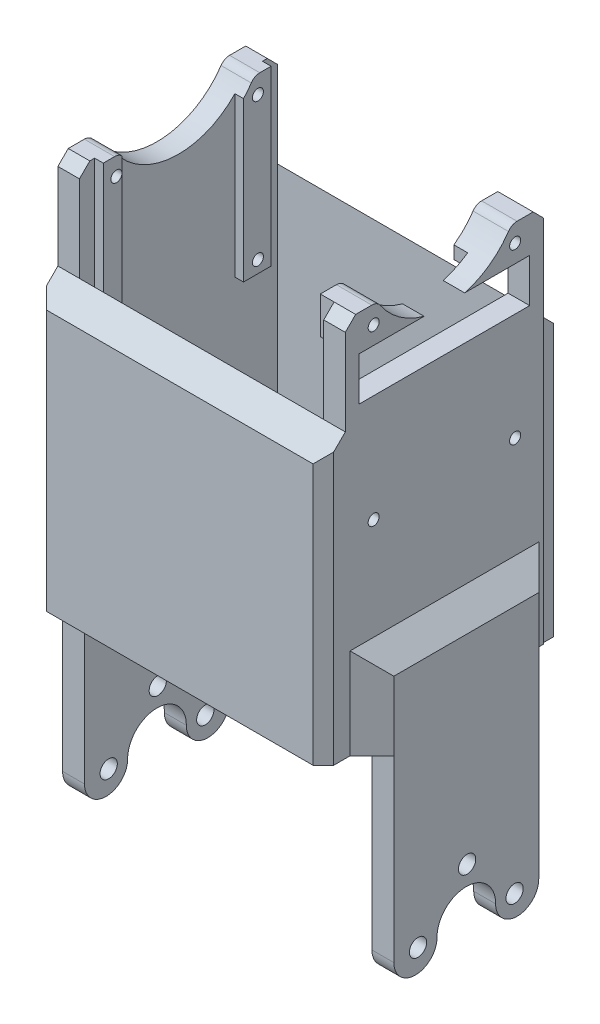
from build123d import *

# Parameters (mm, degrees)
BOSS_EXTRUDE1_DEPTH = 28.72
SKETCH2_R           = 11.2
CUT_EXTRUDE1_DEPTH  = 73.460862022
FILLET2_R           = 1.5
SKETCH3_W           = 41.45
SKETCH3_H           = 41
BOSS_EXTRUDE2_DEPTH = 3.175
SKETCH4_W           = 41.65
SKETCH4_H           = 41
BOSS_EXTRUDE3_DEPTH = 3.175
CHAMFER1_SIZE       = 3.175
CHAMFER2_SIZE       = 1.5
CHAMFER3_SIZE       = 1.5
BOSS_EXTRUDE4_START = 1.25
SKETCH5_R           = 0.8
BOSS_EXTRUDE4_DEPTH = 1.25
CUT_EXTRUDE2_REACH  = 74.059
SKETCH6_R           = 0.8
CUT_EXTRUDE3_REACH  = 76.34
SKETCH7_R           = 1.35
SKETCH8_R           = 0.8
SKETCH8_W           = 28.72
SKETCH8_H           = 4.5
SKETCH8_R_2         = 0.875750987
BOSS_EXTRUDE5_DEPTH = 2
CUT_EXTRUDE4_REACH  = 74.059
SKETCH9_R           = 0.800014392
SKETCH9_R_2         = 0.80001441
SKETCH9_R_3         = 0.800015836
SKETCH9_R_4         = 0.800011974
SKETCH9_W           = 24.720018
SKETCH9_H           = 6.307795688
BOSS_EXTRUDE6_DEPTH = 3.175


# Some blends are built 0.0001 mm under size
with BuildPart() as part:
    # Sketch1 → Boss-Extrude1 (new body)
    with BuildSketch(Plane.XY):
        Polygon((0, 0), (35.4, 0), (35.4, 51.875), (38.525, 51.875), (38.525, -3.125), (-3.125, -3.125), (-3.125, 51.875), (0, 51.875), align=None)
    extrude(amount=BOSS_EXTRUDE1_DEPTH)

    # Sketch2 → Cut-Extrude1 (cut, through all)
    with BuildSketch(Plane(origin=(38.525, 0, 0), x_dir=(0, 0, -1), z_dir=(1, 0, 0))):
        with Locations((-14.36, 57.485)):
            Circle(SKETCH2_R)
    extrude(amount=-CUT_EXTRUDE1_DEPTH, mode=Mode.SUBTRACT)

    # Fillet2
    fillet2_edges = [part.edges().sort_by_distance(p)[0] for p in [
        (-1.5625, 51.875, 4.666295858),
        (-1.5625, 51.875, 24.053704142),
        (36.9625, 51.875, 4.666295858),
        (36.9625, 51.875, 24.053704142),
    ]]
    fillet(fillet2_edges, radius=FILLET2_R)

    # Sketch3 → Boss-Extrude2 (add)
    with BuildSketch(Plane(origin=(0, 0, 0), x_dir=(-1, 0, 0), z_dir=(0, 0, -1))):
        with Locations((-17.6, 17.375)):
            Rectangle(SKETCH3_W, SKETCH3_H)
    extrude(amount=BOSS_EXTRUDE2_DEPTH)

    # Sketch4 → Boss-Extrude3 (add)
    with BuildSketch(Plane.XY.offset(28.72)):
        with Locations((17.7, 17.375)):
            Rectangle(SKETCH4_W, SKETCH4_H)
    extrude(amount=BOSS_EXTRUDE3_DEPTH)

    # Chamfer1
    chamfer1_edges = [part.edges().sort_by_distance(p)[0] for p in [
        (17.6, 37.875, -3.175),
        (17.7, 37.875, 31.895),
    ]]
    chamfer(chamfer1_edges, length=CHAMFER1_SIZE - 0.0001)  # a hair under: the kernel refuses the full size

    # Chamfer2
    chamfer2_edges = [part.edges().sort_by_distance(p)[0] for p in [
        (-1.5625, 51.875, 0),
        (36.9625, 51.875, 28.72),
        (-1.5625, 51.875, 28.72),
        (36.9625, 51.875, 0),
    ]]
    chamfer(chamfer2_edges, length=CHAMFER2_SIZE)

    # Chamfer3
    chamfer3_edges = [part.edges().sort_by_distance(p)[0] for p in [
        (38.325, 15.78755, -3.175),
        (-3.125, 15.78755, 31.895),
        (-3.125, 15.78755, -3.175),
        (38.525, 15.78755, 31.895),
    ]]
    chamfer(chamfer3_edges, length=CHAMFER3_SIZE)

    # Sketch5 → Boss-Extrude4 (add)
    # profile 1 of 2: a face of its own
    with BuildSketch(Plane(origin=(0, 0, 0), x_dir=(0, 0, -1), z_dir=(1, 0, 0)).offset(BOSS_EXTRUDE4_START)):
        with BuildLine():
            Line((-2.200583574, 26.790766865), (-2.200583574, 51.875))
            Line((-2.200583574, 51.875), (-3.836792314, 51.875))
            ThreePointArc((-3.836792314, 51.875), (-4.540480573, 51.699697262), (-5.07969086, 51.21476378))
            ThreePointArc((-5.07969086, 51.21476378), (-5.612003622, 50.491248548), (-6.200583574, 49.812717186))
            Line((-6.200583574, 49.812717186), (-6.200583574, 26.790766865))
            Line((-6.200583574, 26.790766865), (-2.200583574, 26.790766865))
        make_face()
        with Locations((-4.11, 28.560750987)):
            Circle(SKETCH5_R, mode=Mode.SUBTRACT)
        with Locations((-4.11, 49.260750987)):
            Circle(SKETCH5_R, mode=Mode.SUBTRACT)
    # profile 2 of 2: a face of its own
    with BuildSketch(Plane(origin=(0, 0, 0), x_dir=(0, 0, -1), z_dir=(1, 0, 0)).offset(BOSS_EXTRUDE4_START)):
        with BuildLine():
            Line((-23.77972879, 26.790766865), (-23.77972879, 51.391038545))
            ThreePointArc((-23.77972879, 51.391038545), (-24.280736864, 51.748691708), (-24.883207686, 51.875))
            Line((-24.883207686, 51.875), (-26.51940138, 51.875))
            Line((-26.51940138, 51.875), (-26.51940138, 26.790766865))
            Line((-26.51940138, 26.790766865), (-23.77972879, 26.790766865))
        make_face()
        with Locations((-24.61, 28.560750987)):
            Circle(SKETCH5_R, mode=Mode.SUBTRACT)
        with Locations((-24.61, 49.260750987)):
            Circle(SKETCH5_R, mode=Mode.SUBTRACT)
    extrude(amount=-BOSS_EXTRUDE4_DEPTH)

    # Sketch6 → Cut-Extrude2 (cut, up to next)
    with BuildSketch(Plane(origin=(0, 0, 0), x_dir=(0, 0, -1), z_dir=(1, 0, 0)), mode=Mode.PRIVATE) as cut_extrude2_sk1:
        with Locations((-24.61, 49.260750987)):
            Circle(SKETCH6_R)
    cut_extrude2_tool1 = extrude(cut_extrude2_sk1.sketch, amount=-CUT_EXTRUDE2_REACH, mode=Mode.PRIVATE) & part.part
    # Sketch6 → Cut-Extrude2 (cut, up to next)
    with BuildSketch(Plane(origin=(0, 0, 0), x_dir=(0, 0, -1), z_dir=(1, 0, 0)), mode=Mode.PRIVATE) as cut_extrude2_sk2:
        with Locations((-24.61, 28.560750987)):
            Circle(SKETCH6_R)
    cut_extrude2_tool2 = extrude(cut_extrude2_sk2.sketch, amount=-CUT_EXTRUDE2_REACH, mode=Mode.PRIVATE) & part.part
    # Sketch6 → Cut-Extrude2 (cut, up to next)
    with BuildSketch(Plane(origin=(0, 0, 0), x_dir=(0, 0, -1), z_dir=(1, 0, 0)), mode=Mode.PRIVATE) as cut_extrude2_sk3:
        with Locations((-4.11, 28.560750987)):
            Circle(SKETCH6_R)
    cut_extrude2_tool3 = extrude(cut_extrude2_sk3.sketch, amount=-CUT_EXTRUDE2_REACH, mode=Mode.PRIVATE) & part.part
    # Sketch6 → Cut-Extrude2 (cut, up to next)
    with BuildSketch(Plane(origin=(0, 0, 0), x_dir=(0, 0, -1), z_dir=(1, 0, 0)), mode=Mode.PRIVATE) as cut_extrude2_sk4:
        with Locations((-4.11, 49.260750987)):
            Circle(SKETCH6_R)
    cut_extrude2_tool4 = extrude(cut_extrude2_sk4.sketch, amount=-CUT_EXTRUDE2_REACH, mode=Mode.PRIVATE) & part.part
    add(cut_extrude2_tool1.solids().sort_by_distance((0, 49.260751, 24.61))[0], mode=Mode.SUBTRACT)
    add(cut_extrude2_tool2.solids().sort_by_distance((0, 28.560751, 24.61))[0], mode=Mode.SUBTRACT)
    add(cut_extrude2_tool3.solids().sort_by_distance((0, 28.560751, 4.11))[0], mode=Mode.SUBTRACT)
    add(cut_extrude2_tool4.solids().sort_by_distance((0, 49.260751, 4.11))[0], mode=Mode.SUBTRACT)

    # Sketch7 → Cut-Extrude3 (cut, up to next)
    with BuildSketch(Plane.XZ.offset(3.125), mode=Mode.PRIVATE) as cut_extrude3_sk1:
        with Locations(Location((11.7, 22.36, 0), (0, 0, 270))):
            Circle(SKETCH7_R)
    cut_extrude3_tool1 = extrude(cut_extrude3_sk1.sketch, amount=-CUT_EXTRUDE3_REACH, mode=Mode.PRIVATE) & part.part
    # Sketch7 → Cut-Extrude3 (cut, up to next)
    with BuildSketch(Plane.XZ.offset(3.125), mode=Mode.PRIVATE) as cut_extrude3_sk2:
        with Locations(Location((23.7, 22.36, 0), (0, 0, 270))):
            Circle(SKETCH7_R)
    cut_extrude3_tool2 = extrude(cut_extrude3_sk2.sketch, amount=-CUT_EXTRUDE3_REACH, mode=Mode.PRIVATE) & part.part
    # Sketch7 → Cut-Extrude3 (cut, up to next)
    with BuildSketch(Plane.XZ.offset(3.125), mode=Mode.PRIVATE) as cut_extrude3_sk3:
        with Locations(Location((23.7, 6.359998127, 0), (0, 0, 270))):
            Circle(SKETCH7_R)
    cut_extrude3_tool3 = extrude(cut_extrude3_sk3.sketch, amount=-CUT_EXTRUDE3_REACH, mode=Mode.PRIVATE) & part.part
    # Sketch7 → Cut-Extrude3 (cut, up to next)
    with BuildSketch(Plane.XZ.offset(3.125), mode=Mode.PRIVATE) as cut_extrude3_sk4:
        with Locations(Location((11.7, 6.359998127, 0), (0, 0, 270))):
            Circle(SKETCH7_R)
    cut_extrude3_tool4 = extrude(cut_extrude3_sk4.sketch, amount=-CUT_EXTRUDE3_REACH, mode=Mode.PRIVATE) & part.part
    add(cut_extrude3_tool1.solids().sort_by_distance((11.7, -3.125, 22.36))[0], mode=Mode.SUBTRACT)
    add(cut_extrude3_tool2.solids().sort_by_distance((23.7, -3.125, 22.36))[0], mode=Mode.SUBTRACT)
    add(cut_extrude3_tool3.solids().sort_by_distance((23.7, -3.125, 6.359998))[0], mode=Mode.SUBTRACT)
    add(cut_extrude3_tool4.solids().sort_by_distance((11.7, -3.125, 6.359998))[0], mode=Mode.SUBTRACT)

    # Sketch8 → Boss-Extrude5 (add)
    # profile 1 of 3: a face of its own
    with BuildSketch(Plane.ZY.offset(-35.4)):
        with BuildLine():
            ThreePointArc((23.64030914, 51.21476378), (22.377857963, 49.66490066), (20.86, 48.364144777))
            Line((20.86, 48.364144777), (20.86, 46.516373578))
            Line((20.86, 46.516373578), (27.22, 46.516373578))
            Line((27.22, 46.516373578), (27.22, 51.875))
            Line((27.22, 51.875), (24.883207686, 51.875))
            ThreePointArc((24.883207686, 51.875), (24.179519427, 51.699697262), (23.64030914, 51.21476378))
        make_face()
        with Locations(Location((24.61, 49.260750667, 0), (0, 0, 179.999977125))):
            Circle(SKETCH8_R, mode=Mode.SUBTRACT)
    # profile 2 of 3: a face of its own
    with BuildSketch(Plane.ZY.offset(-35.4)):
        with BuildLine():
            Line((3.836792314, 51.875), (1.5, 51.875))
            Line((1.5, 51.875), (1.5, 46.516373578))
            Line((1.5, 46.516373578), (7.86, 46.516373578))
            Line((7.86, 46.516373578), (7.86, 48.364144777))
            ThreePointArc((7.86, 48.364144777), (6.342142037, 49.66490066), (5.07969086, 51.21476378))
            ThreePointArc((5.07969086, 51.21476378), (4.540480573, 51.699697262), (3.836792314, 51.875))
        make_face()
        with Locations(Location((4.11, 49.260750667, 0), (0, 0, 179.999977125))):
            Circle(SKETCH8_R, mode=Mode.SUBTRACT)
    # profile 3 of 3: a face of its own
    with BuildSketch(Plane.ZY.offset(-35.4)):
        with Locations((14.36, 24.810750667)):
            Rectangle(SKETCH8_W, SKETCH8_H)
        with Locations((4.11, 24.810750667)):
            Circle(SKETCH8_R, mode=Mode.SUBTRACT)
        with Locations((24.61, 24.734999681)):
            Circle(SKETCH8_R_2, mode=Mode.SUBTRACT)
    extrude(amount=BOSS_EXTRUDE5_DEPTH)

    # Sketch9 → Cut-Extrude4 (cut, up to next)
    with BuildSketch(Plane.ZY.offset(-35.4), mode=Mode.PRIVATE) as cut_extrude4_sk1:
        with Locations((24.609993853, 24.810730685)):
            Circle(SKETCH9_R)
    cut_extrude4_tool1 = extrude(cut_extrude4_sk1.sketch, amount=-CUT_EXTRUDE4_REACH, mode=Mode.PRIVATE) & part.part
    # Sketch9 → Cut-Extrude4 (cut, up to next)
    with BuildSketch(Plane.ZY.offset(-35.4), mode=Mode.PRIVATE) as cut_extrude4_sk2:
        with Locations((4.109993853, 24.810730685)):
            Circle(SKETCH9_R_2)
    cut_extrude4_tool2 = extrude(cut_extrude4_sk2.sketch, amount=-CUT_EXTRUDE4_REACH, mode=Mode.PRIVATE) & part.part
    # Sketch9 → Cut-Extrude4 (cut, up to next)
    with BuildSketch(Plane.ZY.offset(-35.4), mode=Mode.PRIVATE) as cut_extrude4_sk3:
        with Locations((4.109993242, 49.260730684)):
            Circle(SKETCH9_R_3)
    cut_extrude4_tool3 = extrude(cut_extrude4_sk3.sketch, amount=-CUT_EXTRUDE4_REACH, mode=Mode.PRIVATE) & part.part
    # Sketch9 → Cut-Extrude4 (cut, up to next)
    with BuildSketch(Plane.ZY.offset(-35.4), mode=Mode.PRIVATE) as cut_extrude4_sk4:
        with Locations((24.609993853, 49.260730685)):
            Circle(SKETCH9_R_4)
    cut_extrude4_tool4 = extrude(cut_extrude4_sk4.sketch, amount=-CUT_EXTRUDE4_REACH, mode=Mode.PRIVATE) & part.part
    # Sketch9 → Cut-Extrude4 (cut, up to next)
    with BuildSketch(Plane.ZY.offset(-35.4), mode=Mode.PRIVATE) as cut_extrude4_sk5:
        with Locations((14.359996578, 43.522958594)):
            Rectangle(SKETCH9_W, SKETCH9_H)
    cut_extrude4_tool5 = extrude(cut_extrude4_sk5.sketch, amount=-CUT_EXTRUDE4_REACH, mode=Mode.PRIVATE) & part.part
    add(cut_extrude4_tool1.solids().sort_by_distance((35.4, 24.810731, 24.609994))[0], mode=Mode.SUBTRACT)
    add(cut_extrude4_tool2.solids().sort_by_distance((35.4, 24.810731, 4.109994))[0], mode=Mode.SUBTRACT)
    add(cut_extrude4_tool3.solids().sort_by_distance((35.4, 49.260731, 4.109993))[0], mode=Mode.SUBTRACT)
    add(cut_extrude4_tool4.solids().sort_by_distance((35.4, 49.260731, 24.609994))[0], mode=Mode.SUBTRACT)
    add(cut_extrude4_tool5.solids().sort_by_distance((35.4, 43.522959, 14.359997))[0], mode=Mode.SUBTRACT)

    # Sketch10 → Boss-Extrude6 (add)
    with BuildSketch(Plane.ZY.offset(3.125)):
        with BuildLine():
            Line((3.86000082, 6.875), (24.86000082, 6.875))
            Line((24.86000082, 6.875), (24.86000082, -29.069076968))
            add(Edge.make_bspline(
                [(18.609772252, -29.069076968), (18.609772252, -35.319305536), (24.86000082, -35.319305536), (24.86000082, -29.069076968)],
                knots=[0, 0, 0, 0, 1, 1, 1, 1], degree=3, weights=[1, 0.333333333, 0.333333333, 1]))
            add(Edge.make_bspline(
                [(10.110229389, -29.069076968), (10.084196873, -26.559098439), (11.849887296, -24.775), (14.36000082, -24.775), (16.870114345, -24.775), (18.635804768, -26.559098439), (18.609772252, -29.069076968)],
                knots=[0, 0, 0, 0, 0.5, 0.5, 0.5, 1, 1, 1, 1], degree=3, weights=[1, 0.802287003, 0.802287003, 1, 0.802287003, 0.802287003, 1]))
            add(Edge.make_bspline(
                [(3.86000082, -29.069077053), (3.86000082, -30.899726637), (5.154465564, -32.194191363), (6.985115147, -32.194191338), (8.815764731, -32.194191313), (10.110229439, -30.899726551), (10.110229389, -29.069076968)],
                knots=[0, 0, 0, 0, 0.5, 0.5, 0.5, 1, 1, 1, 1], degree=3, weights=[1, 0.804737851, 0.804737851, 1, 0.804737851, 0.804737851, 1]))
            Line((3.86000082, -29.069077053), (3.86000082, 6.875))
        make_face()
        with BuildLine():
            add(Edge.make_bspline(
                [(6.111158371, -29.163426519), (6.123444486, -29.895556484), (6.649826144, -30.404562953), (7.38195611, -30.392276838)],
                knots=[0, 0, 0, 0, 1, 1, 1, 1], degree=3, weights=[1, 0.804737854, 0.804737854, 1]))
            add(Edge.make_bspline(
                [(6.111158371, -29.163426519), (6.089205787, -27.855271412), (7.289382626, -27.334380583), (8.229910793, -28.24386311), (9.170438961, -29.153345636), (8.690111217, -30.370324254), (7.38195611, -30.392276838)],
                knots=[0, 0, 0, 0, 0.5, 0.5, 0.5, 1, 1, 1, 1], degree=3, weights=[1, 0.588455622, 0.588455622, 1, 0.588455622, 0.588455622, 1]))
        make_face(mode=Mode.SUBTRACT)
        with BuildLine():
            add(Edge.make_bspline(
                [(14.221572316, -20.776159536), (13.489442351, -20.788445651), (12.980435882, -21.314827309), (12.992721997, -22.046957275)],
                knots=[0, 0, 0, 0, 1, 1, 1, 1], degree=3, weights=[1, 0.804737854, 0.804737854, 1]))
            add(Edge.make_bspline(
                [(14.221572316, -20.776159536), (15.529727423, -20.754206952), (16.050618252, -21.954383791), (15.141135725, -22.894911958), (14.231653199, -23.835440126), (13.014674581, -23.355112382), (12.992721997, -22.046957275)],
                knots=[0, 0, 0, 0, 0.5, 0.5, 0.5, 1, 1, 1, 1], degree=3, weights=[1, 0.588455622, 0.588455622, 1, 0.588455622, 0.588455622, 1]))
        make_face(mode=Mode.SUBTRACT)
        with BuildLine():
            add(Edge.make_bspline(
                [(22.608839299, -28.886573481), (22.596553184, -28.154443516), (22.070171526, -27.645437047), (21.33804156, -27.657723162)],
                knots=[0, 0, 0, 0, 1, 1, 1, 1], degree=3, weights=[1, 0.804737854, 0.804737854, 1]))
            add(Edge.make_bspline(
                [(22.608839299, -28.886573481), (22.630791883, -30.194728588), (21.430615044, -30.715619417), (20.490086877, -29.80613689), (19.549558709, -28.896654364), (20.029886453, -27.679675746), (21.33804156, -27.657723162)],
                knots=[0, 0, 0, 0, 0.5, 0.5, 0.5, 1, 1, 1, 1], degree=3, weights=[1, 0.588455622, 0.588455622, 1, 0.588455622, 0.588455622, 1]))
        make_face(mode=Mode.SUBTRACT)
    boss_extrude6 = extrude(amount=BOSS_EXTRUDE6_DEPTH)

    # Chamfer8
    # the kernel refuses this chamfer: 3.175 mm, written as the material it adds along each edge
    with BuildSketch(Plane(origin=(-3.125, -3.125, 3.86000082), x_dir=(0.027495876610586334, 0, -0.9996219169112966), z_dir=(0, 1, 0))) as chamfer8_piece_1_section:
        with BuildLine():
            Line((3.266037395, 0), (-0.179537217, 3.261098994))
            Line((-0.179537217, 3.261098994), (-0.243013208, 3.259353006))
            ThreePointArc((-0.243013208, 3.259353006), (-0.108360296, 1.630038109), (-0.063475992, -0.001745988))
            Line((-0.063475992, -0.001745988), (0.001745988, -0.063475992))
            ThreePointArc((0.001745988, -0.063475992), (1.633530085, -0.018591688), (3.267783383, -0.063475992))
            Line((3.267783383, -0.063475992), (3.266037395, 0))
        make_face()
    chamfer8_piece_1 = extrude(amount=10, mode=Mode.PRIVATE)
    chamfer8_piece_1 = split(chamfer8_piece_1, bisect_by=Plane(origin=(-3.125, 1.875, 2.852266819), z_dir=(-1, 0, 0)), keep=Keep.TOP, mode=Mode.PRIVATE)
    chamfer8_piece_1 = split(chamfer8_piece_1, bisect_by=Plane(origin=(-6.3, 1.875, 2.852266819), z_dir=(1, 0, 0)), keep=Keep.TOP, mode=Mode.PRIVATE)
    add(chamfer8_piece_1)
    with BuildSketch(Plane(origin=(-3.125, 6.875, 3.86000082), x_dir=(0.02749587661058633, 0.9996219169112966, 0), z_dir=(0, 0, 1))) as chamfer8_piece_2_section:
        with BuildLine():
            Line((3.266037395, 0), (-0.179537217, 3.261098994))
            Line((-0.179537217, 3.261098994), (-0.243013208, 3.259353006))
            ThreePointArc((-0.243013208, 3.259353006), (-0.108360296, 1.630038109), (-0.063475992, -0.001745988))
            Line((-0.063475992, -0.001745988), (0.001745988, -0.063475992))
            ThreePointArc((0.001745988, -0.063475992), (1.633530085, -0.018591688), (3.267783383, -0.063475992))
            Line((3.267783383, -0.063475992), (3.266037395, 0))
        make_face()
    chamfer8_piece_2 = extrude(amount=21, mode=Mode.PRIVATE)
    chamfer8_piece_2 = split(chamfer8_piece_2, bisect_by=Plane(origin=(-6.3, 7.92403319, 14.36000082), z_dir=(1, 0, 0)), keep=Keep.TOP, mode=Mode.PRIVATE)
    add(chamfer8_piece_2)
    with BuildSketch(Plane(origin=(-3.125, 6.875, 24.86000082), x_dir=(0.02749587661058632, 0, 0.9996219169112968), z_dir=(0, -1, 0))) as chamfer8_piece_3_section:
        with BuildLine():
            Line((3.266037395, 0), (-0.179537217, 3.261098994))
            Line((-0.179537217, 3.261098994), (-0.243013208, 3.259353006))
            ThreePointArc((-0.243013208, 3.259353006), (-0.108360296, 1.630038109), (-0.063475992, -0.001745988))
            Line((-0.063475992, -0.001745988), (0.001745988, -0.063475992))
            ThreePointArc((0.001745988, -0.063475992), (1.633530085, -0.018591688), (3.267783383, -0.063475992))
            Line((3.267783383, -0.063475992), (3.266037395, 0))
        make_face()
    chamfer8_piece_3 = extrude(amount=10, mode=Mode.PRIVATE)
    chamfer8_piece_3 = split(chamfer8_piece_3, bisect_by=Plane(origin=(-3.125, 1.875, 25.867734822), z_dir=(-1, 0, 0)), keep=Keep.TOP, mode=Mode.PRIVATE)
    chamfer8_piece_3 = split(chamfer8_piece_3, bisect_by=Plane(origin=(-6.3, 1.875, 25.867734822), z_dir=(1, 0, 0)), keep=Keep.TOP, mode=Mode.PRIVATE)
    add(chamfer8_piece_3)
    with BuildSketch(Plane(origin=(-3.125, 6.875, -4.305092666), x_dir=(0.02749587661058633, 0.9996219169112966, 0), z_dir=(0, 0, 1))) as chamfer8_piece_4a_section:
        with BuildLine():
            Line((3.266037395, 0), (-0.179537217, 3.261098994))
            Line((-0.179537217, 3.261098994), (-0.243013208, 3.259353006))
            ThreePointArc((-0.243013208, 3.259353006), (-0.108360296, 1.630038109), (-0.063475992, -0.001745988))
            Line((-0.063475992, -0.001745988), (0.001745988, -0.063475992))
            ThreePointArc((0.001745988, -0.063475992), (1.633530085, -0.018591688), (3.267783383, -0.063475992))
            Line((3.267783383, -0.063475992), (3.266037395, 0))
        make_face()
    chamfer8_piece_4a = extrude(amount=29.165093487, mode=Mode.PRIVATE)
    chamfer8_piece_4a = split(chamfer8_piece_4a, bisect_by=Plane(origin=(-5.18557266, 7.999418049, 0.38557266), z_dir=(0.7071067811865476, 0, 0.7071067811865476)), keep=Keep.TOP, mode=Mode.PRIVATE)
    chamfer8_piece_4a = split(chamfer8_piece_4a, bisect_by=Plane(origin=(-4.02742994, 7.999418049, 3.86000082), z_dir=(0, 0, -1)), keep=Keep.TOP, mode=Mode.PRIVATE)
    chamfer8_piece_4a = split(chamfer8_piece_4a, bisect_by=Plane(origin=(-6.3, 7.999418049, 1.54371538), z_dir=(1, 0, 0)), keep=Keep.TOP, mode=Mode.PRIVATE)
    with BuildSketch(Plane(origin=(-3.125, -3.125, 3.86000082), x_dir=(0.027495876610586334, 0, -0.9996219169112966), z_dir=(0, 1, 0))) as chamfer8_piece_4b_section:
        with BuildLine():
            Line((3.266037395, 0), (-0.179537217, 3.261098994))
            Line((-0.179537217, 3.261098994), (-0.243013208, 3.259353006))
            ThreePointArc((-0.243013208, 3.259353006), (-0.108360296, 1.630038109), (-0.063475992, -0.001745988))
            Line((-0.063475992, -0.001745988), (0.001745988, -0.063475992))
            ThreePointArc((0.001745988, -0.063475992), (1.633530085, -0.018591688), (3.267783383, -0.063475992))
            Line((3.267783383, -0.063475992), (3.266037395, 0))
        make_face()
    chamfer8_piece_4b = extrude(amount=10, mode=Mode.PRIVATE)
    chamfer8_piece_4b = split(chamfer8_piece_4b, bisect_by=Plane(origin=(-3.125, 1.875, 1.952472958), z_dir=(1, 0, 0)), keep=Keep.TOP, mode=Mode.PRIVATE)
    chamfer8_piece_4 = chamfer8_piece_4a & chamfer8_piece_4b
    add(chamfer8_piece_4)
    with BuildSketch(Plane(origin=(-3.125, 6.875, -4.305092666), x_dir=(0.02749587661058633, 0.9996219169112966, 0), z_dir=(0, 0, 1))) as chamfer8_piece_5a_section:
        with BuildLine():
            Line((3.266037395, 0), (-0.179537217, 3.261098994))
            Line((-0.179537217, 3.261098994), (-0.243013208, 3.259353006))
            ThreePointArc((-0.243013208, 3.259353006), (-0.108360296, 1.630038109), (-0.063475992, -0.001745988))
            Line((-0.063475992, -0.001745988), (0.001745988, -0.063475992))
            ThreePointArc((0.001745988, -0.063475992), (1.633530085, -0.018591688), (3.267783383, -0.063475992))
            Line((3.267783383, -0.063475992), (3.266037395, 0))
        make_face()
    chamfer8_piece_5a = extrude(amount=29.165093487, mode=Mode.PRIVATE)
    chamfer8_piece_5a = split(chamfer8_piece_5a, bisect_by=Plane(origin=(-5.18557266, 7.999418049, 0.38557266), z_dir=(0.7071067811865476, 0, 0.7071067811865476)), keep=Keep.TOP, mode=Mode.PRIVATE)
    chamfer8_piece_5a = split(chamfer8_piece_5a, bisect_by=Plane(origin=(-4.02742994, 7.999418049, 3.86000082), z_dir=(0, 0, -1)), keep=Keep.TOP, mode=Mode.PRIVATE)
    chamfer8_piece_5a = split(chamfer8_piece_5a, bisect_by=Plane(origin=(-6.3, 7.999418049, 1.54371538), z_dir=(1, 0, 0)), keep=Keep.TOP, mode=Mode.PRIVATE)
    with BuildSketch(Plane(origin=(-3.125, -3.125, 3.86000082), x_dir=(0.027495876610586334, 0, -0.9996219169112966), z_dir=(0, 1, 0))) as chamfer8_piece_5b_section:
        with BuildLine():
            Line((3.266037395, 0), (-0.179537217, 3.261098994))
            Line((-0.179537217, 3.261098994), (-0.243013208, 3.259353006))
            ThreePointArc((-0.243013208, 3.259353006), (-0.108360296, 1.630038109), (-0.063475992, -0.001745988))
            Line((-0.063475992, -0.001745988), (0.001745988, -0.063475992))
            ThreePointArc((0.001745988, -0.063475992), (1.633530085, -0.018591688), (3.267783383, -0.063475992))
            Line((3.267783383, -0.063475992), (3.266037395, 0))
        make_face()
    chamfer8_piece_5b = extrude(amount=18.165093487, mode=Mode.PRIVATE)
    chamfer8_piece_5b = split(chamfer8_piece_5b, bisect_by=Plane(origin=(-3.08030238, 6.875, 1.952472958), z_dir=(0, 1, 0)), keep=Keep.TOP, mode=Mode.PRIVATE)
    chamfer8_piece_5b = split(chamfer8_piece_5b, bisect_by=Plane(origin=(-3.125, 10.957546743, 1.952472958), z_dir=(1, 0, 0)), keep=Keep.TOP, mode=Mode.PRIVATE)
    chamfer8_piece_5 = chamfer8_piece_5a & chamfer8_piece_5b
    add(chamfer8_piece_5)
    with BuildSketch(Plane(origin=(-3.125, 6.875, -4.305092666), x_dir=(0.02749587661058633, 0.9996219169112966, 0), z_dir=(0, 0, 1))) as chamfer8_piece_6a_section:
        with BuildLine():
            Line((3.266037395, 0), (-0.179537217, 3.261098994))
            Line((-0.179537217, 3.261098994), (-0.243013208, 3.259353006))
            ThreePointArc((-0.243013208, 3.259353006), (-0.108360296, 1.630038109), (-0.063475992, -0.001745988))
            Line((-0.063475992, -0.001745988), (0.001745988, -0.063475992))
            ThreePointArc((0.001745988, -0.063475992), (1.633530085, -0.018591688), (3.267783383, -0.063475992))
            Line((3.267783383, -0.063475992), (3.266037395, 0))
        make_face()
    chamfer8_piece_6a = extrude(amount=29.165093487, mode=Mode.PRIVATE)
    chamfer8_piece_6a = split(chamfer8_piece_6a, bisect_by=Plane(origin=(-5.18557266, 7.999418049, 0.38557266), z_dir=(0.7071067811865476, 0, 0.7071067811865476)), keep=Keep.TOP, mode=Mode.PRIVATE)
    chamfer8_piece_6a = split(chamfer8_piece_6a, bisect_by=Plane(origin=(-4.02742994, 7.999418049, 3.86000082), z_dir=(0, 0, -1)), keep=Keep.TOP, mode=Mode.PRIVATE)
    chamfer8_piece_6a = split(chamfer8_piece_6a, bisect_by=Plane(origin=(-6.3, 7.999418049, 1.54371538), z_dir=(1, 0, 0)), keep=Keep.TOP, mode=Mode.PRIVATE)
    with BuildSketch(Plane(origin=(-3.125, -3.125, 3.86000082), x_dir=(0.027495876610586334, 0, -0.9996219169112966), z_dir=(0, 1, 0))) as chamfer8_piece_6b_section:
        with BuildLine():
            Line((3.266037395, 0), (-0.179537217, 3.261098994))
            Line((-0.179537217, 3.261098994), (-0.243013208, 3.259353006))
            ThreePointArc((-0.243013208, 3.259353006), (-0.108360296, 1.630038109), (-0.063475992, -0.001745988))
            Line((-0.063475992, -0.001745988), (0.001745988, -0.063475992))
            ThreePointArc((0.001745988, -0.063475992), (1.633530085, -0.018591688), (3.267783383, -0.063475992))
            Line((3.267783383, -0.063475992), (3.266037395, 0))
        make_face()
    chamfer8_piece_6b = extrude(amount=18.165093487, mode=Mode.PRIVATE)
    chamfer8_piece_6b = split(chamfer8_piece_6b, bisect_by=Plane(origin=(-4.22075927, 6.875, 2.852266819), z_dir=(0, 1, 0)), keep=Keep.TOP, mode=Mode.PRIVATE)
    chamfer8_piece_6b = split(chamfer8_piece_6b, bisect_by=Plane(origin=(-3.125, 10.957546743, 2.852266819), z_dir=(-1, 0, 0)), keep=Keep.TOP, mode=Mode.PRIVATE)
    chamfer8_piece_6b = split(chamfer8_piece_6b, bisect_by=Plane(origin=(-6.3, 10.957546743, 2.852266819), z_dir=(1, 0, 0)), keep=Keep.TOP, mode=Mode.PRIVATE)
    chamfer8_piece_6 = chamfer8_piece_6a & chamfer8_piece_6b
    add(chamfer8_piece_6)
    with BuildSketch(Plane(origin=(-3.125, 15.040093487, 24.86000082), x_dir=(0.02749587661058632, 0, 0.9996219169112968), z_dir=(0, -1, 0))) as chamfer8_piece_7a_section:
        with BuildLine():
            Line((3.266037395, 0), (-0.179537217, 3.261098994))
            Line((-0.179537217, 3.261098994), (-0.243013208, 3.259353006))
            ThreePointArc((-0.243013208, 3.259353006), (-0.108360296, 1.630038109), (-0.063475992, -0.001745988))
            Line((-0.063475992, -0.001745988), (0.001745988, -0.063475992))
            ThreePointArc((0.001745988, -0.063475992), (1.633530085, -0.018591688), (3.267783383, -0.063475992))
            Line((3.267783383, -0.063475992), (3.266037395, 0))
        make_face()
    chamfer8_piece_7a = extrude(amount=18.165093487, mode=Mode.PRIVATE)
    chamfer8_piece_7a = split(chamfer8_piece_7a, bisect_by=Plane(origin=(-3.08030238, 6.875, 26.767528683), z_dir=(0, 1, 0)), keep=Keep.TOP, mode=Mode.PRIVATE)
    chamfer8_piece_7a = split(chamfer8_piece_7a, bisect_by=Plane(origin=(-3.125, 10.957546743, 26.767528683), z_dir=(1, 0, 0)), keep=Keep.TOP, mode=Mode.PRIVATE)
    with BuildSketch(Plane(origin=(-3.125, 6.875, 3.86000082), x_dir=(0.02749587661058633, 0.9996219169112966, 0), z_dir=(0, 0, 1))) as chamfer8_piece_7b_section:
        with BuildLine():
            Line((3.266037395, 0), (-0.179537217, 3.261098994))
            Line((-0.179537217, 3.261098994), (-0.243013208, 3.259353006))
            ThreePointArc((-0.243013208, 3.259353006), (-0.108360296, 1.630038109), (-0.063475992, -0.001745988))
            Line((-0.063475992, -0.001745988), (0.001745988, -0.063475992))
            ThreePointArc((0.001745988, -0.063475992), (1.633530085, -0.018591688), (3.267783383, -0.063475992))
            Line((3.267783383, -0.063475992), (3.266037395, 0))
        make_face()
    chamfer8_piece_7b = extrude(amount=29.165093487, mode=Mode.PRIVATE)
    chamfer8_piece_7b = split(chamfer8_piece_7b, bisect_by=Plane(origin=(-5.185572211, 7.999418077, 28.334427789), z_dir=(0.7071067811865476, 0, -0.7071067811865476)), keep=Keep.TOP, mode=Mode.PRIVATE)
    chamfer8_piece_7b = split(chamfer8_piece_7b, bisect_by=Plane(origin=(-4.027429888, 7.999418077, 24.86000082), z_dir=(0, 0, 1)), keep=Keep.TOP, mode=Mode.PRIVATE)
    chamfer8_piece_7b = split(chamfer8_piece_7b, bisect_by=Plane(origin=(-6.3, 7.999418077, 27.176285466), z_dir=(1, 0, 0)), keep=Keep.TOP, mode=Mode.PRIVATE)
    chamfer8_piece_7 = chamfer8_piece_7a & chamfer8_piece_7b
    add(chamfer8_piece_7)
    with BuildSketch(Plane(origin=(-3.125, 15.040093487, 24.86000082), x_dir=(0.02749587661058632, 0, 0.9996219169112968), z_dir=(0, -1, 0))) as chamfer8_piece_8a_section:
        with BuildLine():
            Line((3.266037395, 0), (-0.179537217, 3.261098994))
            Line((-0.179537217, 3.261098994), (-0.243013208, 3.259353006))
            ThreePointArc((-0.243013208, 3.259353006), (-0.108360296, 1.630038109), (-0.063475992, -0.001745988))
            Line((-0.063475992, -0.001745988), (0.001745988, -0.063475992))
            ThreePointArc((0.001745988, -0.063475992), (1.633530085, -0.018591688), (3.267783383, -0.063475992))
            Line((3.267783383, -0.063475992), (3.266037395, 0))
        make_face()
    chamfer8_piece_8a = extrude(amount=18.165093487, mode=Mode.PRIVATE)
    chamfer8_piece_8a = split(chamfer8_piece_8a, bisect_by=Plane(origin=(-4.22075927, 6.875, 25.867734822), z_dir=(0, 1, 0)), keep=Keep.TOP, mode=Mode.PRIVATE)
    chamfer8_piece_8a = split(chamfer8_piece_8a, bisect_by=Plane(origin=(-3.125, 10.957546743, 25.867734822), z_dir=(-1, 0, 0)), keep=Keep.TOP, mode=Mode.PRIVATE)
    chamfer8_piece_8a = split(chamfer8_piece_8a, bisect_by=Plane(origin=(-6.3, 10.957546743, 25.867734822), z_dir=(1, 0, 0)), keep=Keep.TOP, mode=Mode.PRIVATE)
    with BuildSketch(Plane(origin=(-3.125, 6.875, 3.86000082), x_dir=(0.02749587661058633, 0.9996219169112966, 0), z_dir=(0, 0, 1))) as chamfer8_piece_8b_section:
        with BuildLine():
            Line((3.266037395, 0), (-0.179537217, 3.261098994))
            Line((-0.179537217, 3.261098994), (-0.243013208, 3.259353006))
            ThreePointArc((-0.243013208, 3.259353006), (-0.108360296, 1.630038109), (-0.063475992, -0.001745988))
            Line((-0.063475992, -0.001745988), (0.001745988, -0.063475992))
            ThreePointArc((0.001745988, -0.063475992), (1.633530085, -0.018591688), (3.267783383, -0.063475992))
            Line((3.267783383, -0.063475992), (3.266037395, 0))
        make_face()
    chamfer8_piece_8b = extrude(amount=29.165093487, mode=Mode.PRIVATE)
    chamfer8_piece_8b = split(chamfer8_piece_8b, bisect_by=Plane(origin=(-5.185572211, 7.999418077, 28.334427789), z_dir=(0.7071067811865476, 0, -0.7071067811865476)), keep=Keep.TOP, mode=Mode.PRIVATE)
    chamfer8_piece_8b = split(chamfer8_piece_8b, bisect_by=Plane(origin=(-4.027429888, 7.999418077, 24.86000082), z_dir=(0, 0, 1)), keep=Keep.TOP, mode=Mode.PRIVATE)
    chamfer8_piece_8b = split(chamfer8_piece_8b, bisect_by=Plane(origin=(-6.3, 7.999418077, 27.176285466), z_dir=(1, 0, 0)), keep=Keep.TOP, mode=Mode.PRIVATE)
    chamfer8_piece_8 = chamfer8_piece_8a & chamfer8_piece_8b
    add(chamfer8_piece_8)
    with BuildSketch(Plane(origin=(-3.125, 6.875, 24.86000082), x_dir=(0.02749587661058632, 0, 0.9996219169112968), z_dir=(0, -1, 0))) as chamfer8_piece_9a_section:
        with BuildLine():
            Line((3.266037395, 0), (-0.179537217, 3.261098994))
            Line((-0.179537217, 3.261098994), (-0.243013208, 3.259353006))
            ThreePointArc((-0.243013208, 3.259353006), (-0.108360296, 1.630038109), (-0.063475992, -0.001745988))
            Line((-0.063475992, -0.001745988), (0.001745988, -0.063475992))
            ThreePointArc((0.001745988, -0.063475992), (1.633530085, -0.018591688), (3.267783383, -0.063475992))
            Line((3.267783383, -0.063475992), (3.266037395, 0))
        make_face()
    chamfer8_piece_9a = extrude(amount=10, mode=Mode.PRIVATE)
    chamfer8_piece_9a = split(chamfer8_piece_9a, bisect_by=Plane(origin=(-3.125, 1.875, 26.767528683), z_dir=(1, 0, 0)), keep=Keep.TOP, mode=Mode.PRIVATE)
    with BuildSketch(Plane(origin=(-3.125, 6.875, 3.86000082), x_dir=(0.02749587661058633, 0.9996219169112966, 0), z_dir=(0, 0, 1))) as chamfer8_piece_9b_section:
        with BuildLine():
            Line((3.266037395, 0), (-0.179537217, 3.261098994))
            Line((-0.179537217, 3.261098994), (-0.243013208, 3.259353006))
            ThreePointArc((-0.243013208, 3.259353006), (-0.108360296, 1.630038109), (-0.063475992, -0.001745988))
            Line((-0.063475992, -0.001745988), (0.001745988, -0.063475992))
            ThreePointArc((0.001745988, -0.063475992), (1.633530085, -0.018591688), (3.267783383, -0.063475992))
            Line((3.267783383, -0.063475992), (3.266037395, 0))
        make_face()
    chamfer8_piece_9b = extrude(amount=29.165093487, mode=Mode.PRIVATE)
    chamfer8_piece_9b = split(chamfer8_piece_9b, bisect_by=Plane(origin=(-5.185572211, 7.999418077, 28.334427789), z_dir=(0.7071067811865476, 0, -0.7071067811865476)), keep=Keep.TOP, mode=Mode.PRIVATE)
    chamfer8_piece_9b = split(chamfer8_piece_9b, bisect_by=Plane(origin=(-4.027429888, 7.999418077, 24.86000082), z_dir=(0, 0, 1)), keep=Keep.TOP, mode=Mode.PRIVATE)
    chamfer8_piece_9b = split(chamfer8_piece_9b, bisect_by=Plane(origin=(-6.3, 7.999418077, 27.176285466), z_dir=(1, 0, 0)), keep=Keep.TOP, mode=Mode.PRIVATE)
    chamfer8_piece_9 = chamfer8_piece_9a & chamfer8_piece_9b
    add(chamfer8_piece_9)

    # Mirror2: Boss-Extrude6 across plane
    add(boss_extrude6.mirror(Plane(origin=(17.7, 0, 0), x_dir=(0, 0, 1), z_dir=(1, 0, 0))))

    # Chamfer9
    # the kernel refuses this chamfer: 3.175 mm, written as the material it adds along each edge
    with BuildSketch(Plane(origin=(38.525, 6.875, 24.86000082), x_dir=(-0.027495876610583465, 0, 0.9996219169112968), z_dir=(0, -1, 0))) as chamfer9_piece_1_section:
        with BuildLine():
            Line((3.266037395, 0), (-0.179537217, -3.261098994))
            Line((-0.179537217, -3.261098994), (-0.243013208, -3.259353006))
            ThreePointArc((-0.243013208, -3.259353006), (-0.108360296, -1.630038109), (-0.063475992, 0.001745988))
            Line((-0.063475992, 0.001745988), (0.001745988, 0.063475992))
            ThreePointArc((0.001745988, 0.063475992), (1.633530085, 0.018591688), (3.267783383, 0.063475992))
            Line((3.267783383, 0.063475992), (3.266037395, 0))
        make_face()
    chamfer9_piece_1 = extrude(amount=10, mode=Mode.PRIVATE)
    chamfer9_piece_1 = split(chamfer9_piece_1, bisect_by=Plane(origin=(38.525, 1.875, 25.867734822), z_dir=(1, 0, 0)), keep=Keep.TOP, mode=Mode.PRIVATE)
    chamfer9_piece_1 = split(chamfer9_piece_1, bisect_by=Plane(origin=(41.7, 1.875, 25.867734822), z_dir=(-1, 0, 0)), keep=Keep.TOP, mode=Mode.PRIVATE)
    add(chamfer9_piece_1)
    with BuildSketch(Plane(origin=(38.525, 6.875, 3.86000082), x_dir=(-0.02749587661058348, 0.9996219169112968, 0), z_dir=(0, 0, 1))) as chamfer9_piece_2_section:
        with BuildLine():
            Line((3.266037395, 0), (-0.179537217, -3.261098994))
            Line((-0.179537217, -3.261098994), (-0.243013208, -3.259353006))
            ThreePointArc((-0.243013208, -3.259353006), (-0.108360296, -1.630038109), (-0.063475992, 0.001745988))
            Line((-0.063475992, 0.001745988), (0.001745988, 0.063475992))
            ThreePointArc((0.001745988, 0.063475992), (1.633530085, 0.018591688), (3.267783383, 0.063475992))
            Line((3.267783383, 0.063475992), (3.266037395, 0))
        make_face()
    chamfer9_piece_2 = extrude(amount=21, mode=Mode.PRIVATE)
    chamfer9_piece_2 = split(chamfer9_piece_2, bisect_by=Plane(origin=(41.7, 7.92403319, 14.36000082), z_dir=(-1, 0, 0)), keep=Keep.TOP, mode=Mode.PRIVATE)
    add(chamfer9_piece_2)
    with BuildSketch(Plane(origin=(38.525, -3.125, 3.86000082), x_dir=(-0.027495876610583486, 0, -0.9996219169112968), z_dir=(0, 1, 0))) as chamfer9_piece_3_section:
        with BuildLine():
            Line((3.266037395, 0), (-0.179537217, -3.261098994))
            Line((-0.179537217, -3.261098994), (-0.243013208, -3.259353006))
            ThreePointArc((-0.243013208, -3.259353006), (-0.108360296, -1.630038109), (-0.063475992, 0.001745988))
            Line((-0.063475992, 0.001745988), (0.001745988, 0.063475992))
            ThreePointArc((0.001745988, 0.063475992), (1.633530085, 0.018591688), (3.267783383, 0.063475992))
            Line((3.267783383, 0.063475992), (3.266037395, 0))
        make_face()
    chamfer9_piece_3 = extrude(amount=10, mode=Mode.PRIVATE)
    chamfer9_piece_3 = split(chamfer9_piece_3, bisect_by=Plane(origin=(38.525, 1.875, 2.852266819), z_dir=(1, 0, 0)), keep=Keep.TOP, mode=Mode.PRIVATE)
    chamfer9_piece_3 = split(chamfer9_piece_3, bisect_by=Plane(origin=(41.7, 1.875, 2.852266819), z_dir=(-1, 0, 0)), keep=Keep.TOP, mode=Mode.PRIVATE)
    add(chamfer9_piece_3)
    with BuildSketch(Plane(origin=(38.525, 6.875, 3.86000082), x_dir=(-0.02749587661058348, 0.9996219169112968, 0), z_dir=(0, 0, 1))) as chamfer9_piece_4a_section:
        with BuildLine():
            Line((3.266037395, 0), (-0.179537217, -3.261098994))
            Line((-0.179537217, -3.261098994), (-0.243013208, -3.259353006))
            ThreePointArc((-0.243013208, -3.259353006), (-0.108360296, -1.630038109), (-0.063475992, 0.001745988))
            Line((-0.063475992, 0.001745988), (0.001745988, 0.063475992))
            ThreePointArc((0.001745988, 0.063475992), (1.633530085, 0.018591688), (3.267783383, 0.063475992))
            Line((3.267783383, 0.063475992), (3.266037395, 0))
        make_face()
    chamfer9_piece_4a = extrude(amount=29.165093487, mode=Mode.PRIVATE)
    chamfer9_piece_4a = split(chamfer9_piece_4a, bisect_by=Plane(origin=(40.585572211, 7.999418077, 28.334427789), z_dir=(-0.7071067811865476, 0, -0.7071067811865476)), keep=Keep.TOP, mode=Mode.PRIVATE)
    chamfer9_piece_4a = split(chamfer9_piece_4a, bisect_by=Plane(origin=(39.427429888, 7.999418077, 24.86000082), z_dir=(0, 0, 1)), keep=Keep.TOP, mode=Mode.PRIVATE)
    chamfer9_piece_4a = split(chamfer9_piece_4a, bisect_by=Plane(origin=(41.7, 7.999418077, 27.176285466), z_dir=(-1, 0, 0)), keep=Keep.TOP, mode=Mode.PRIVATE)
    with BuildSketch(Plane(origin=(38.525, 15.040093487, 24.86000082), x_dir=(-0.02749587661058564, 0, 0.9996219169112968), z_dir=(0, -1, 0))) as chamfer9_piece_4b_section:
        with BuildLine():
            Line((3.266037395, 0), (-0.179537217, -3.261098994))
            Line((-0.179537217, -3.261098994), (-0.243013208, -3.259353006))
            ThreePointArc((-0.243013208, -3.259353006), (-0.108360296, -1.630038109), (-0.063475992, 0.001745988))
            Line((-0.063475992, 0.001745988), (0.001745988, 0.063475992))
            ThreePointArc((0.001745988, 0.063475992), (1.633530085, 0.018591688), (3.267783383, 0.063475992))
            Line((3.267783383, 0.063475992), (3.266037395, 0))
        make_face()
    chamfer9_piece_4b = extrude(amount=18.165093487, mode=Mode.PRIVATE)
    chamfer9_piece_4b = split(chamfer9_piece_4b, bisect_by=Plane(origin=(38.525, 10.957546743, 26.767528683), z_dir=(-1, 0, 0)), keep=Keep.TOP, mode=Mode.PRIVATE)
    chamfer9_piece_4b = split(chamfer9_piece_4b, bisect_by=Plane(origin=(38.48030238, 6.875, 26.767528683), z_dir=(0, 1, 0)), keep=Keep.TOP, mode=Mode.PRIVATE)
    chamfer9_piece_4 = chamfer9_piece_4a & chamfer9_piece_4b
    add(chamfer9_piece_4)
    with BuildSketch(Plane(origin=(38.525, 6.875, 3.86000082), x_dir=(-0.02749587661058348, 0.9996219169112968, 0), z_dir=(0, 0, 1))) as chamfer9_piece_5a_section:
        with BuildLine():
            Line((3.266037395, 0), (-0.179537217, -3.261098994))
            Line((-0.179537217, -3.261098994), (-0.243013208, -3.259353006))
            ThreePointArc((-0.243013208, -3.259353006), (-0.108360296, -1.630038109), (-0.063475992, 0.001745988))
            Line((-0.063475992, 0.001745988), (0.001745988, 0.063475992))
            ThreePointArc((0.001745988, 0.063475992), (1.633530085, 0.018591688), (3.267783383, 0.063475992))
            Line((3.267783383, 0.063475992), (3.266037395, 0))
        make_face()
    chamfer9_piece_5a = extrude(amount=29.165093487, mode=Mode.PRIVATE)
    chamfer9_piece_5a = split(chamfer9_piece_5a, bisect_by=Plane(origin=(40.585572211, 7.999418077, 28.334427789), z_dir=(-0.7071067811865476, 0, -0.7071067811865476)), keep=Keep.TOP, mode=Mode.PRIVATE)
    chamfer9_piece_5a = split(chamfer9_piece_5a, bisect_by=Plane(origin=(39.427429888, 7.999418077, 24.86000082), z_dir=(0, 0, 1)), keep=Keep.TOP, mode=Mode.PRIVATE)
    chamfer9_piece_5a = split(chamfer9_piece_5a, bisect_by=Plane(origin=(41.7, 7.999418077, 27.176285466), z_dir=(-1, 0, 0)), keep=Keep.TOP, mode=Mode.PRIVATE)
    with BuildSketch(Plane(origin=(38.525, 15.040093487, 24.86000082), x_dir=(-0.02749587661058564, 0, 0.9996219169112968), z_dir=(0, -1, 0))) as chamfer9_piece_5b_section:
        with BuildLine():
            Line((3.266037395, 0), (-0.179537217, -3.261098994))
            Line((-0.179537217, -3.261098994), (-0.243013208, -3.259353006))
            ThreePointArc((-0.243013208, -3.259353006), (-0.108360296, -1.630038109), (-0.063475992, 0.001745988))
            Line((-0.063475992, 0.001745988), (0.001745988, 0.063475992))
            ThreePointArc((0.001745988, 0.063475992), (1.633530085, 0.018591688), (3.267783383, 0.063475992))
            Line((3.267783383, 0.063475992), (3.266037395, 0))
        make_face()
    chamfer9_piece_5b = extrude(amount=18.165093487, mode=Mode.PRIVATE)
    chamfer9_piece_5b = split(chamfer9_piece_5b, bisect_by=Plane(origin=(38.525, 10.957546743, 25.867734822), z_dir=(1, 0, 0)), keep=Keep.TOP, mode=Mode.PRIVATE)
    chamfer9_piece_5b = split(chamfer9_piece_5b, bisect_by=Plane(origin=(39.62075927, 6.875, 25.867734822), z_dir=(0, 1, 0)), keep=Keep.TOP, mode=Mode.PRIVATE)
    chamfer9_piece_5b = split(chamfer9_piece_5b, bisect_by=Plane(origin=(41.7, 10.957546743, 25.867734822), z_dir=(-1, 0, 0)), keep=Keep.TOP, mode=Mode.PRIVATE)
    chamfer9_piece_5 = chamfer9_piece_5a & chamfer9_piece_5b
    add(chamfer9_piece_5)
    with BuildSketch(Plane(origin=(38.525, 6.875, 3.86000082), x_dir=(-0.02749587661058348, 0.9996219169112968, 0), z_dir=(0, 0, 1))) as chamfer9_piece_6a_section:
        with BuildLine():
            Line((3.266037395, 0), (-0.179537217, -3.261098994))
            Line((-0.179537217, -3.261098994), (-0.243013208, -3.259353006))
            ThreePointArc((-0.243013208, -3.259353006), (-0.108360296, -1.630038109), (-0.063475992, 0.001745988))
            Line((-0.063475992, 0.001745988), (0.001745988, 0.063475992))
            ThreePointArc((0.001745988, 0.063475992), (1.633530085, 0.018591688), (3.267783383, 0.063475992))
            Line((3.267783383, 0.063475992), (3.266037395, 0))
        make_face()
    chamfer9_piece_6a = extrude(amount=29.165093487, mode=Mode.PRIVATE)
    chamfer9_piece_6a = split(chamfer9_piece_6a, bisect_by=Plane(origin=(40.585572211, 7.999418077, 28.334427789), z_dir=(-0.7071067811865476, 0, -0.7071067811865476)), keep=Keep.TOP, mode=Mode.PRIVATE)
    chamfer9_piece_6a = split(chamfer9_piece_6a, bisect_by=Plane(origin=(39.427429888, 7.999418077, 24.86000082), z_dir=(0, 0, 1)), keep=Keep.TOP, mode=Mode.PRIVATE)
    chamfer9_piece_6a = split(chamfer9_piece_6a, bisect_by=Plane(origin=(41.7, 7.999418077, 27.176285466), z_dir=(-1, 0, 0)), keep=Keep.TOP, mode=Mode.PRIVATE)
    with BuildSketch(Plane(origin=(38.525, 6.875, 24.86000082), x_dir=(-0.027495876610583465, 0, 0.9996219169112968), z_dir=(0, -1, 0))) as chamfer9_piece_6b_section:
        with BuildLine():
            Line((3.266037395, 0), (-0.179537217, -3.261098994))
            Line((-0.179537217, -3.261098994), (-0.243013208, -3.259353006))
            ThreePointArc((-0.243013208, -3.259353006), (-0.108360296, -1.630038109), (-0.063475992, 0.001745988))
            Line((-0.063475992, 0.001745988), (0.001745988, 0.063475992))
            ThreePointArc((0.001745988, 0.063475992), (1.633530085, 0.018591688), (3.267783383, 0.063475992))
            Line((3.267783383, 0.063475992), (3.266037395, 0))
        make_face()
    chamfer9_piece_6b = extrude(amount=10, mode=Mode.PRIVATE)
    chamfer9_piece_6b = split(chamfer9_piece_6b, bisect_by=Plane(origin=(38.525, 1.875, 26.767528683), z_dir=(-1, 0, 0)), keep=Keep.TOP, mode=Mode.PRIVATE)
    chamfer9_piece_6 = chamfer9_piece_6a & chamfer9_piece_6b
    add(chamfer9_piece_6)
    with BuildSketch(Plane(origin=(38.525, -3.125, 3.86000082), x_dir=(-0.027495876610583486, 0, -0.9996219169112968), z_dir=(0, 1, 0))) as chamfer9_piece_7a_section:
        with BuildLine():
            Line((3.266037395, 0), (-0.179537217, -3.261098994))
            Line((-0.179537217, -3.261098994), (-0.243013208, -3.259353006))
            ThreePointArc((-0.243013208, -3.259353006), (-0.108360296, -1.630038109), (-0.063475992, 0.001745988))
            Line((-0.063475992, 0.001745988), (0.001745988, 0.063475992))
            ThreePointArc((0.001745988, 0.063475992), (1.633530085, 0.018591688), (3.267783383, 0.063475992))
            Line((3.267783383, 0.063475992), (3.266037395, 0))
        make_face()
    chamfer9_piece_7a = extrude(amount=10, mode=Mode.PRIVATE)
    chamfer9_piece_7a = split(chamfer9_piece_7a, bisect_by=Plane(origin=(38.525, 1.875, 1.952472958), z_dir=(-1, 0, 0)), keep=Keep.TOP, mode=Mode.PRIVATE)
    with BuildSketch(Plane(origin=(38.525, 6.875, -4.305092666), x_dir=(-0.027495876610585654, 0.9996219169112968, 0), z_dir=(0, 0, 1))) as chamfer9_piece_7b_section:
        with BuildLine():
            Line((3.266037395, 0), (-0.179537217, -3.261098994))
            Line((-0.179537217, -3.261098994), (-0.243013208, -3.259353006))
            ThreePointArc((-0.243013208, -3.259353006), (-0.108360296, -1.630038109), (-0.063475992, 0.001745988))
            Line((-0.063475992, 0.001745988), (0.001745988, 0.063475992))
            ThreePointArc((0.001745988, 0.063475992), (1.633530085, 0.018591688), (3.267783383, 0.063475992))
            Line((3.267783383, 0.063475992), (3.266037395, 0))
        make_face()
    chamfer9_piece_7b = extrude(amount=29.165093487, mode=Mode.PRIVATE)
    chamfer9_piece_7b = split(chamfer9_piece_7b, bisect_by=Plane(origin=(39.56841401, 7.92403319, 0), z_dir=(0, 0, 1)), keep=Keep.TOP, mode=Mode.PRIVATE)
    chamfer9_piece_7b = split(chamfer9_piece_7b, bisect_by=Plane(origin=(39.56841401, 7.92403319, 3.86000082), z_dir=(0, 0, -1)), keep=Keep.TOP, mode=Mode.PRIVATE)
    chamfer9_piece_7b = split(chamfer9_piece_7b, bisect_by=Plane(origin=(41.7, 7.92403319, 1.93000041), z_dir=(-1, 0, 0)), keep=Keep.TOP, mode=Mode.PRIVATE)
    chamfer9_piece_7 = chamfer9_piece_7a & chamfer9_piece_7b
    add(chamfer9_piece_7)
    with BuildSketch(Plane(origin=(38.525, -3.125, 3.86000082), x_dir=(-0.027495876610583486, 0, -0.9996219169112968), z_dir=(0, 1, 0))) as chamfer9_piece_8a_section:
        with BuildLine():
            Line((3.266037395, 0), (-0.179537217, -3.261098994))
            Line((-0.179537217, -3.261098994), (-0.243013208, -3.259353006))
            ThreePointArc((-0.243013208, -3.259353006), (-0.108360296, -1.630038109), (-0.063475992, 0.001745988))
            Line((-0.063475992, 0.001745988), (0.001745988, 0.063475992))
            ThreePointArc((0.001745988, 0.063475992), (1.633530085, 0.018591688), (3.267783383, 0.063475992))
            Line((3.267783383, 0.063475992), (3.266037395, 0))
        make_face()
    chamfer9_piece_8a = extrude(amount=18.165093487, mode=Mode.PRIVATE)
    chamfer9_piece_8a = split(chamfer9_piece_8a, bisect_by=Plane(origin=(38.525, 10.957546743, 1.952472958), z_dir=(-1, 0, 0)), keep=Keep.TOP, mode=Mode.PRIVATE)
    chamfer9_piece_8a = split(chamfer9_piece_8a, bisect_by=Plane(origin=(38.48030238, 6.875, 1.952472958), z_dir=(0, 1, 0)), keep=Keep.TOP, mode=Mode.PRIVATE)
    with BuildSketch(Plane(origin=(38.525, 6.875, -4.305092666), x_dir=(-0.027495876610585654, 0.9996219169112968, 0), z_dir=(0, 0, 1))) as chamfer9_piece_8b_section:
        with BuildLine():
            Line((3.266037395, 0), (-0.179537217, -3.261098994))
            Line((-0.179537217, -3.261098994), (-0.243013208, -3.259353006))
            ThreePointArc((-0.243013208, -3.259353006), (-0.108360296, -1.630038109), (-0.063475992, 0.001745988))
            Line((-0.063475992, 0.001745988), (0.001745988, 0.063475992))
            ThreePointArc((0.001745988, 0.063475992), (1.633530085, 0.018591688), (3.267783383, 0.063475992))
            Line((3.267783383, 0.063475992), (3.266037395, 0))
        make_face()
    chamfer9_piece_8b = extrude(amount=29.165093487, mode=Mode.PRIVATE)
    chamfer9_piece_8b = split(chamfer9_piece_8b, bisect_by=Plane(origin=(39.56841401, 7.92403319, 0), z_dir=(0, 0, 1)), keep=Keep.TOP, mode=Mode.PRIVATE)
    chamfer9_piece_8b = split(chamfer9_piece_8b, bisect_by=Plane(origin=(39.56841401, 7.92403319, 3.86000082), z_dir=(0, 0, -1)), keep=Keep.TOP, mode=Mode.PRIVATE)
    chamfer9_piece_8b = split(chamfer9_piece_8b, bisect_by=Plane(origin=(41.7, 7.92403319, 1.93000041), z_dir=(-1, 0, 0)), keep=Keep.TOP, mode=Mode.PRIVATE)
    chamfer9_piece_8 = chamfer9_piece_8a & chamfer9_piece_8b
    add(chamfer9_piece_8)
    with BuildSketch(Plane(origin=(38.525, -3.125, 3.86000082), x_dir=(-0.027495876610583486, 0, -0.9996219169112968), z_dir=(0, 1, 0))) as chamfer9_piece_9a_section:
        with BuildLine():
            Line((3.266037395, 0), (-0.179537217, -3.261098994))
            Line((-0.179537217, -3.261098994), (-0.243013208, -3.259353006))
            ThreePointArc((-0.243013208, -3.259353006), (-0.108360296, -1.630038109), (-0.063475992, 0.001745988))
            Line((-0.063475992, 0.001745988), (0.001745988, 0.063475992))
            ThreePointArc((0.001745988, 0.063475992), (1.633530085, 0.018591688), (3.267783383, 0.063475992))
            Line((3.267783383, 0.063475992), (3.266037395, 0))
        make_face()
    chamfer9_piece_9a = extrude(amount=18.165093487, mode=Mode.PRIVATE)
    chamfer9_piece_9a = split(chamfer9_piece_9a, bisect_by=Plane(origin=(38.525, 10.957546743, 2.852266819), z_dir=(1, 0, 0)), keep=Keep.TOP, mode=Mode.PRIVATE)
    chamfer9_piece_9a = split(chamfer9_piece_9a, bisect_by=Plane(origin=(39.62075927, 6.875, 2.852266819), z_dir=(0, 1, 0)), keep=Keep.TOP, mode=Mode.PRIVATE)
    chamfer9_piece_9a = split(chamfer9_piece_9a, bisect_by=Plane(origin=(41.7, 10.957546743, 2.852266819), z_dir=(-1, 0, 0)), keep=Keep.TOP, mode=Mode.PRIVATE)
    with BuildSketch(Plane(origin=(38.525, 6.875, -4.305092666), x_dir=(-0.027495876610585654, 0.9996219169112968, 0), z_dir=(0, 0, 1))) as chamfer9_piece_9b_section:
        with BuildLine():
            Line((3.266037395, 0), (-0.179537217, -3.261098994))
            Line((-0.179537217, -3.261098994), (-0.243013208, -3.259353006))
            ThreePointArc((-0.243013208, -3.259353006), (-0.108360296, -1.630038109), (-0.063475992, 0.001745988))
            Line((-0.063475992, 0.001745988), (0.001745988, 0.063475992))
            ThreePointArc((0.001745988, 0.063475992), (1.633530085, 0.018591688), (3.267783383, 0.063475992))
            Line((3.267783383, 0.063475992), (3.266037395, 0))
        make_face()
    chamfer9_piece_9b = extrude(amount=29.165093487, mode=Mode.PRIVATE)
    chamfer9_piece_9b = split(chamfer9_piece_9b, bisect_by=Plane(origin=(39.56841401, 7.92403319, 0), z_dir=(0, 0, 1)), keep=Keep.TOP, mode=Mode.PRIVATE)
    chamfer9_piece_9b = split(chamfer9_piece_9b, bisect_by=Plane(origin=(39.56841401, 7.92403319, 3.86000082), z_dir=(0, 0, -1)), keep=Keep.TOP, mode=Mode.PRIVATE)
    chamfer9_piece_9b = split(chamfer9_piece_9b, bisect_by=Plane(origin=(41.7, 7.92403319, 1.93000041), z_dir=(-1, 0, 0)), keep=Keep.TOP, mode=Mode.PRIVATE)
    chamfer9_piece_9 = chamfer9_piece_9a & chamfer9_piece_9b
    add(chamfer9_piece_9)


solid = part.part
